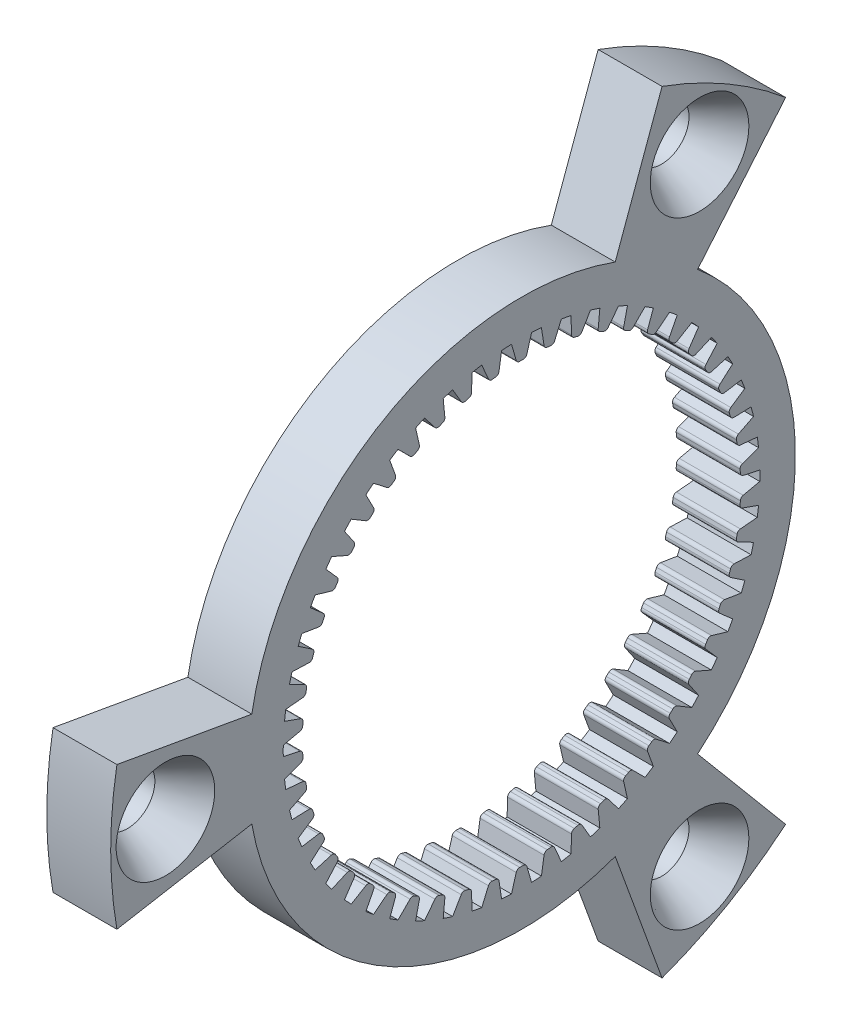
from build123d import *

# Parameters (mm, degrees)
SKETCH1_W                     = 3.5
SKETCH1_H                     = 22.5
CUT_EXTRUDE1_DEPTH            = 33.011716605
CUT_EXTRUDE2_DEPTH            = 33.011716605
CUT_EXTRUDE3_DEPTH            = 33.011716605
CUT_EXTRUDE4_DEPTH            = 32.07297861
CSK_FOR_M3_SFHCS1_D           = 3
CSK_FOR_M3_SFHCS1_DEPTH       = 9.5
CSK_FOR_M3_SFHCS1_CSINK_D     = 5.4
CSK_FOR_M3_SFHCS1_CSINK_ANGLE = 60
CSK_FOR_M3_SFHCS1_TIP         = 0.901290929
FILLET1_R                     = 0.2
CIRPATTERN1_START             = -1.5
CIRPATTERN1_DEPTH             = 3.5


# Read off the part's stored shape, not the designer's step: CirPattern1
with BuildPart() as part:
    # Sketch1 → Revolve1 (revolve)
    with BuildSketch(Plane.XY, mode=Mode.PRIVATE) as revolve1_sk:
        with Locations((0.25, 11.25)):
            Rectangle(SKETCH1_W, SKETCH1_H)
    revolve(revolve1_sk.sketch.rotate(Axis((-1.5, 0, 0), (1, 0, 0)), 270), axis=Axis((-1.5, 0, 0), (1, 0, 0)))

    # Sketch2 → Cut-Extrude1 (cut, through all)
    with BuildSketch(Plane.ZY.offset(1.5)):
        with BuildLine():
            Line((22.158174437, -3.907084003), (14.77211629, -2.604722668))
            ThreePointArc((14.77211629, -2.604722668), (7.499999995, -12.990381056), (-5.130302151, -14.095389311))
            Line((-5.130302151, -14.095389311), (-7.695453225, -21.143083968))
            ThreePointArc((-7.695453225, -21.143083968), (11.249999994, -19.485571584), (22.158174437, -3.907084003))
        make_face()
    extrude(amount=-CUT_EXTRUDE1_DEPTH, mode=Mode.SUBTRACT)

    # Sketch3 → Cut-Extrude2 (cut, through all)
    with BuildSketch(Plane.ZY.offset(1.5)):
        with BuildLine():
            Line((-14.462721218, -17.23599997), (-9.641814144, -11.490666648))
            ThreePointArc((-9.641814144, -11.490666648), (-14.999999996, -2e-09), (-9.641814142, 11.490666643))
            Line((-9.641814142, 11.490666643), (-14.462721215, 17.235999966))
            ThreePointArc((-14.462721215, 17.235999966), (-22.499999996, -1e-09), (-14.462721218, -17.23599997))
        make_face()
    extrude(amount=-CUT_EXTRUDE2_DEPTH, mode=Mode.SUBTRACT)

    # Sketch4 → Cut-Extrude3 (cut, through all)
    with BuildSketch(Plane.ZY.offset(1.5)):
        with BuildLine():
            Line((-7.695453229, 21.143083966), (-5.130302153, 14.095389311))
            ThreePointArc((-5.130302153, 14.095389311), (7.500000001, 12.990381056), (14.772116296, 2.60472266))
            Line((14.772116296, 2.60472266), (22.158174444, 3.90708399))
            ThreePointArc((22.158174444, 3.90708399), (11.250000001, 19.485571584), (-7.695453229, 21.143083966))
        make_face()
    extrude(amount=-CUT_EXTRUDE3_DEPTH, mode=Mode.SUBTRACT)

    # Sketch5 → Cut-Extrude4 (cut, through all)
    with BuildSketch(Plane.ZY.offset(1.5)):
        with BuildLine():
            Line((11.958023801, 1.002829383), (12.978235019, 1.366717155))
            ThreePointArc((12.978235019, 1.366717155), (12.947096852, 1.635598699), (12.910388636, 1.903776582))
            Line((12.910388636, 1.903776582), (11.83173402, 2.002515937))
            ThreePointArc((11.83173402, 2.002515937), (11.787447009, 2.248575775), (11.738043363, 2.493659563))
            Line((11.738043363, 2.493659563), (12.704602679, 2.982544343))
            ThreePointArc((12.704602679, 2.982544343), (12.640010253, 3.245403028), (12.569979891, 3.506865488))
            Line((12.569979891, 3.506865488), (11.487455466, 3.469634984))
            ThreePointArc((11.487455466, 3.469634984), (11.412678196, 3.708203932), (11.332946969, 3.945163242))
            Line((11.332946969, 3.945163242), (12.230611166, 4.551335025))
            ThreePointArc((12.230611166, 4.551335025), (12.133583141, 4.804025412), (12.031335054, 5.05464903))
            Line((12.031335054, 5.05464903), (10.962012876, 4.882035815))
            ThreePointArc((10.962012876, 4.882035815), (10.85792463, 5.109351498), (10.749123231, 5.33444934))
            Line((10.749123231, 5.33444934), (11.563735608, 6.048348435))
            ThreePointArc((11.563735608, 6.048348435), (11.435802174, 6.286885447), (11.302948875, 6.522717741))
            Line((11.302948875, 6.522717741), (10.263692795, 6.217444025))
            ThreePointArc((10.263692795, 6.217444025), (10.131935106, 6.429921539), (9.995779399, 6.639607986))
            Line((9.995779399, 6.639607986), (10.714493032, 7.449975777))
            ThreePointArc((10.714493032, 7.449975777), (10.557671777, 7.670597542), (10.396308442, 7.887919293))
            Line((10.396308442, 7.887919293), (9.403508148, 7.454799428))
            ThreePointArc((9.403508148, 7.454799428), (9.246158914, 7.649087876), (9.084796155, 7.840056047))
            Line((9.084796155, 7.840056047), (9.6962765, 8.73411255))
            ThreePointArc((9.6962765, 8.73411255), (9.513040588, 8.933339732), (9.325712014, 9.128723647))
            Line((9.325712014, 9.128723647), (8.39502456, 8.574588191))
            ThreePointArc((8.39502456, 8.574588191), (8.21456527, 8.74762353), (8.030540244, 8.916861745))
            Line((8.030540244, 8.916861745), (8.525143895, 9.880507151))
            ThreePointArc((8.525143895, 9.880507151), (8.318383067, 10.055197817), (8.108043537, 10.225562576))
            Line((8.108043537, 10.225562576), (7.254146419, 9.559150576))
            ThreePointArc((7.254146419, 9.559150576), (7.053423027, 9.708203933), (6.849637921, 9.853043203))
            Line((6.849637921, 9.853043203), (7.219564679, 10.871080252))
            ThreePointArc((7.219564679, 10.871080252), (6.992539674, 11.018479428), (6.762506366, 11.161138278))
            Line((6.762506366, 11.161138278), (5.998866056, 10.392959446))
            ThreePointArc((5.998866056, 10.392959446), (5.781044088, 10.515680161), (5.560712715, 10.633836283))
            Line((5.560712715, 10.633836283), (5.800128615, 11.690209923))
            ThreePointArc((5.800128615, 11.690209923), (5.556419755, 11.807993035), (5.310320434, 11.920696158))
            Line((5.310320434, 11.920696158), (4.648979992, 11.062865137))
            ThreePointArc((4.648979992, 11.062865137), (4.417494632, 11.157317831), (4.184091749, 11.246927413))
            Line((4.184091749, 11.246927413), (4.289221057, 12.324978001))
            ThreePointArc((4.289221057, 12.324978001), (4.032671777, 12.411287537), (3.774387577, 12.492257539))
            Line((3.774387577, 12.492257539), (3.225776736, 11.558302836))
            ThreePointArc((3.225776736, 11.558302836), (2.984278646, 11.622997933), (2.741485156, 11.682647779))
            Line((2.741485156, 11.682647779), (2.710669922, 12.765373812))
            ThreePointArc((2.710669922, 12.765373812), (2.445326155, 12.818848622), (2.17893037, 12.866808557))
            Line((2.17893037, 12.866808557), (1.751701054, 11.871459195))
            ThreePointArc((1.751701054, 11.871459195), (1.503998804, 11.905376416), (1.255643705, 11.934125811))
            Line((1.255643705, 11.934125811), (1.089369902, 13.004452054))
            ThreePointArc((1.089369902, 13.004452054), (0.81941628, 13.024248806), (0.549110132, 13.038442317))
            Line((0.549110132, 13.038442317), (0.25, 11.997395551))
            ThreePointArc((0.25, 11.997395551), (1e-09, 12), (-0.249999997, 11.997395551))
            Line((-0.249999997, 11.997395551), (-0.549110132, 13.038442317))
            ThreePointArc((-0.549110132, 13.038442317), (-0.819416279, 13.024248806), (-1.0893699, 13.004452054))
            Line((-1.0893699, 13.004452054), (-1.255643703, 11.934125812))
            ThreePointArc((-1.255643703, 11.934125812), (-1.503998803, 11.905376416), (-1.751701056, 11.871459195))
            Line((-1.751701056, 11.871459195), (-2.17893037, 12.866808557))
            ThreePointArc((-2.17893037, 12.866808557), (-2.445326153, 12.818848622), (-2.710669918, 12.765373813))
            Line((-2.710669918, 12.765373813), (-2.741485155, 11.68264778))
            ThreePointArc((-2.741485155, 11.68264778), (-2.984278646, 11.622997933), (-3.225776737, 11.558302836))
            Line((-3.225776737, 11.558302836), (-3.774387576, 12.492257539))
            ThreePointArc((-3.774387576, 12.492257539), (-4.032671778, 12.411287537), (-4.289221059, 12.324978))
            Line((-4.289221059, 12.324978), (-4.184091749, 11.246927413))
            ThreePointArc((-4.184091749, 11.246927413), (-4.417494632, 11.157317831), (-4.648979992, 11.062865137))
            Line((-4.648979992, 11.062865137), (-5.310320434, 11.920696158))
            ThreePointArc((-5.310320434, 11.920696158), (-5.556419755, 11.807993035), (-5.800128615, 11.690209923))
            Line((-5.800128615, 11.690209923), (-5.560712716, 10.633836283))
            ThreePointArc((-5.560712716, 10.633836283), (-5.781044089, 10.515680161), (-5.998866056, 10.392959446))
            Line((-5.998866056, 10.392959446), (-6.762506367, 11.161138277))
            ThreePointArc((-6.762506367, 11.161138277), (-6.992539674, 11.018479428), (-7.219564678, 10.871080253))
            Line((-7.219564678, 10.871080253), (-6.849637922, 9.853043202))
            ThreePointArc((-6.849637922, 9.853043202), (-7.053423027, 9.708203933), (-7.254146418, 9.559150576))
            Line((-7.254146418, 9.559150576), (-8.108043535, 10.225562578))
            ThreePointArc((-8.108043535, 10.225562578), (-8.318383066, 10.055197818), (-8.525143896, 9.880507151))
            Line((-8.525143896, 9.880507151), (-8.030540246, 8.916861744))
            ThreePointArc((-8.030540246, 8.916861744), (-8.21456527, 8.74762353), (-8.395024558, 8.574588192))
            Line((-8.395024558, 8.574588192), (-9.325712013, 9.128723648))
            ThreePointArc((-9.325712013, 9.128723648), (-9.513040588, 8.933339732), (-9.696276499, 8.73411255))
            Line((-9.696276499, 8.73411255), (-9.084796153, 7.840056049))
            ThreePointArc((-9.084796153, 7.840056049), (-9.246158912, 7.649087878), (-9.403508146, 7.45479943))
            Line((-9.403508146, 7.45479943), (-10.396308442, 7.887919294))
            ThreePointArc((-10.396308442, 7.887919294), (-10.557671776, 7.670597543), (-10.714493031, 7.449975778))
            Line((-10.714493031, 7.449975778), (-9.995779398, 6.639607987))
            ThreePointArc((-9.995779398, 6.639607987), (-10.131935107, 6.429921539), (-10.263692796, 6.217444023))
            Line((-10.263692796, 6.217444023), (-11.302948876, 6.52271774))
            ThreePointArc((-11.302948876, 6.52271774), (-11.435802174, 6.286885448), (-11.563735606, 6.048348438))
            Line((-11.563735606, 6.048348438), (-10.749123231, 5.334449341))
            ThreePointArc((-10.749123231, 5.334449341), (-10.85792463, 5.109351498), (-10.962012877, 4.882035814))
            Line((-10.962012877, 4.882035814), (-12.031335054, 5.054649031))
            ThreePointArc((-12.031335054, 5.054649031), (-12.133583141, 4.804025412), (-12.230611166, 4.551335023))
            Line((-12.230611166, 4.551335023), (-11.332946969, 3.945163242))
            ThreePointArc((-11.332946969, 3.945163242), (-11.412678196, 3.708203932), (-11.487455466, 3.469634984))
            Line((-11.487455466, 3.469634984), (-12.569979891, 3.506865487))
            ThreePointArc((-12.569979891, 3.506865487), (-12.640010253, 3.245403027), (-12.704602679, 2.982544343))
            Line((-12.704602679, 2.982544343), (-11.738043363, 2.493659563))
            ThreePointArc((-11.738043363, 2.493659563), (-11.787447009, 2.248575775), (-11.83173402, 2.002515937))
            Line((-11.83173402, 2.002515937), (-12.910388636, 1.90377658))
            ThreePointArc((-12.910388636, 1.90377658), (-12.947096852, 1.635598698), (-12.978235019, 1.366717156))
            Line((-12.978235019, 1.366717156), (-11.958023801, 1.002829382))
            ThreePointArc((-11.958023801, 1.002829382), (-11.976320741, 0.753486235), (-11.989419061, 0.503816019))
            Line((-11.989419061, 0.503816019), (-13.04719284, 0.270663979))
            ThreePointArc((-13.04719284, 0.270663979), (-13.05, -1e-09), (-13.04719284, -0.270663981))
            Line((-13.04719284, -0.270663981), (-11.989419061, -0.503816018))
            ThreePointArc((-11.989419061, -0.503816018), (-11.976320741, -0.753486235), (-11.958023801, -1.002829382))
            Line((-11.958023801, -1.002829382), (-12.978235019, -1.366717157))
            ThreePointArc((-12.978235019, -1.366717157), (-12.947096852, -1.635598699), (-12.910388636, -1.90377658))
            Line((-12.910388636, -1.90377658), (-11.83173402, -2.002515936))
            ThreePointArc((-11.83173402, -2.002515936), (-11.787447009, -2.248575775), (-11.738043363, -2.493659563))
            Line((-11.738043363, -2.493659563), (-12.704602679, -2.982544343))
            ThreePointArc((-12.704602679, -2.982544343), (-12.640010253, -3.245403027), (-12.569979891, -3.506865487))
            Line((-12.569979891, -3.506865487), (-11.487455466, -3.469634983))
            ThreePointArc((-11.487455466, -3.469634983), (-11.412678196, -3.708203931), (-11.332946969, -3.945163242))
            Line((-11.332946969, -3.945163242), (-12.230611166, -4.551335024))
            ThreePointArc((-12.230611166, -4.551335024), (-12.133583141, -4.804025412), (-12.031335054, -5.054649031))
            Line((-12.031335054, -5.054649031), (-10.962012877, -4.882035813))
            ThreePointArc((-10.962012877, -4.882035813), (-10.85792463, -5.109351497), (-10.749123231, -5.334449341))
            Line((-10.749123231, -5.334449341), (-11.563735609, -6.048348433))
            ThreePointArc((-11.563735609, -6.048348433), (-11.435802175, -6.286885446), (-11.302948876, -6.52271774))
            Line((-11.302948876, -6.52271774), (-10.263692794, -6.217444027))
            ThreePointArc((-10.263692794, -6.217444027), (-10.131935105, -6.429921541), (-9.995779398, -6.639607987))
            Line((-9.995779398, -6.639607987), (-10.714493034, -7.449975773))
            ThreePointArc((-10.714493034, -7.449975773), (-10.557671778, -7.670597541), (-10.396308442, -7.887919294))
            Line((-10.396308442, -7.887919294), (-9.403508147, -7.454799429))
            ThreePointArc((-9.403508147, -7.454799429), (-9.246158913, -7.649087878), (-9.084796153, -7.840056049))
            Line((-9.084796153, -7.840056049), (-9.696276504, -8.734112546))
            ThreePointArc((-9.696276504, -8.734112546), (-9.51304059, -8.93333973), (-9.325712013, -9.128723648))
            Line((-9.325712013, -9.128723648), (-8.395024559, -8.574588191))
            ThreePointArc((-8.395024559, -8.574588191), (-8.214565271, -8.747623529), (-8.030540246, -8.916861744))
            Line((-8.030540246, -8.916861744), (-8.525143893, -9.880507153))
            ThreePointArc((-8.525143893, -9.880507153), (-8.318383065, -10.055197819), (-8.108043535, -10.225562578))
            Line((-8.108043535, -10.225562578), (-7.254146419, -9.559150576))
            ThreePointArc((-7.254146419, -9.559150576), (-7.053423027, -9.708203933), (-6.849637922, -9.853043202))
            Line((-6.849637922, -9.853043202), (-7.219564677, -10.871080253))
            ThreePointArc((-7.219564677, -10.871080253), (-6.992539674, -11.018479428), (-6.762506367, -11.161138277))
            Line((-6.762506367, -11.161138277), (-5.998866057, -10.392959445))
            ThreePointArc((-5.998866057, -10.392959445), (-5.78104409, -10.51568016), (-5.560712716, -10.633836283))
            Line((-5.560712716, -10.633836283), (-5.800128615, -11.690209923))
            ThreePointArc((-5.800128615, -11.690209923), (-5.556419755, -11.807993035), (-5.310320434, -11.920696158))
            Line((-5.310320434, -11.920696158), (-4.648979993, -11.062865136))
            ThreePointArc((-4.648979993, -11.062865136), (-4.417494633, -11.15731783), (-4.184091749, -11.246927413))
            Line((-4.184091749, -11.246927413), (-4.289221058, -12.324978))
            ThreePointArc((-4.289221058, -12.324978), (-4.032671777, -12.411287537), (-3.774387576, -12.492257539))
            Line((-3.774387576, -12.492257539), (-3.225776739, -11.558302835))
            ThreePointArc((-3.225776739, -11.558302835), (-2.984278647, -11.622997933), (-2.741485155, -11.68264778))
            Line((-2.741485155, -11.68264778), (-2.710669925, -12.765373812))
            ThreePointArc((-2.710669925, -12.765373812), (-2.445326157, -12.818848622), (-2.17893037, -12.866808557))
            Line((-2.17893037, -12.866808557), (-1.751701051, -11.871459195))
            ThreePointArc((-1.751701051, -11.871459195), (-1.503998801, -11.905376416), (-1.255643703, -11.934125812))
            Line((-1.255643703, -11.934125812), (-1.089369906, -13.004452053))
            ThreePointArc((-1.089369906, -13.004452053), (-0.819416282, -13.024248806), (-0.549110132, -13.038442317))
            Line((-0.549110132, -13.038442317), (-0.249999998, -11.997395551))
            ThreePointArc((-0.249999998, -11.997395551), (1e-09, -12), (0.25, -11.997395551))
            Line((0.25, -11.997395551), (0.549110126, -13.038442317))
            ThreePointArc((0.549110126, -13.038442317), (0.819416277, -13.024248806), (1.089369902, -13.004452054))
            Line((1.089369902, -13.004452054), (1.255643704, -11.934125812))
            ThreePointArc((1.255643704, -11.934125812), (1.503998803, -11.905376416), (1.751701054, -11.871459195))
            Line((1.751701054, -11.871459195), (2.178930373, -12.866808556))
            ThreePointArc((2.178930373, -12.866808556), (2.445326157, -12.818848622), (2.710669922, -12.765373812))
            Line((2.710669922, -12.765373812), (2.741485155, -11.68264778))
            ThreePointArc((2.741485155, -11.68264778), (2.984278646, -11.622997934), (3.225776736, -11.558302836))
            Line((3.225776736, -11.558302836), (3.774387577, -12.492257539))
            ThreePointArc((3.774387577, -12.492257539), (4.032671777, -12.411287537), (4.289221057, -12.324978001))
            Line((4.289221057, -12.324978001), (4.184091748, -11.246927413))
            ThreePointArc((4.184091748, -11.246927413), (4.417494632, -11.157317831), (4.648979992, -11.062865137))
            Line((4.648979992, -11.062865137), (5.310320434, -11.920696158))
            ThreePointArc((5.310320434, -11.920696158), (5.556419755, -11.807993034), (5.800128615, -11.690209923))
            Line((5.800128615, -11.690209923), (5.560712715, -10.633836283))
            ThreePointArc((5.560712715, -10.633836283), (5.781044088, -10.515680161), (5.998866056, -10.392959446))
            Line((5.998866056, -10.392959446), (6.762506366, -11.161138277))
            ThreePointArc((6.762506366, -11.161138277), (6.992539674, -11.018479428), (7.219564679, -10.871080252))
            Line((7.219564679, -10.871080252), (6.84963792, -9.853043203))
            ThreePointArc((6.84963792, -9.853043203), (7.053423026, -9.708203933), (7.254146419, -9.559150576))
            Line((7.254146419, -9.559150576), (8.108043533, -10.225562579))
            ThreePointArc((8.108043533, -10.225562579), (8.318383065, -10.055197819), (8.525143895, -9.880507151))
            Line((8.525143895, -9.880507151), (8.030540248, -8.916861742))
            ThreePointArc((8.030540248, -8.916861742), (8.214565272, -8.747623528), (8.39502456, -8.574588191))
            Line((8.39502456, -8.574588191), (9.32571201, -9.128723651))
            ThreePointArc((9.32571201, -9.128723651), (9.513040587, -8.933339734), (9.6962765, -8.73411255))
            Line((9.6962765, -8.73411255), (9.084796154, -7.840056048))
            ThreePointArc((9.084796154, -7.840056048), (9.246158914, -7.649087876), (9.403508148, -7.454799428))
            Line((9.403508148, -7.454799428), (10.396308438, -7.887919298))
            ThreePointArc((10.396308438, -7.887919298), (10.557671775, -7.670597545), (10.714493032, -7.449975777))
            Line((10.714493032, -7.449975777), (9.995779399, -6.639607986))
            ThreePointArc((9.995779399, -6.639607986), (10.131935106, -6.429921539), (10.263692795, -6.217444025))
            Line((10.263692795, -6.217444025), (11.302948877, -6.522717737))
            ThreePointArc((11.302948877, -6.522717737), (11.435802175, -6.286885446), (11.563735608, -6.048348435))
            Line((11.563735608, -6.048348435), (10.749123231, -5.334449341))
            ThreePointArc((10.749123231, -5.334449341), (10.85792463, -5.109351498), (10.962012876, -4.882035815))
            Line((10.962012876, -4.882035815), (12.031335054, -5.05464903))
            ThreePointArc((12.031335054, -5.05464903), (12.133583141, -4.804025412), (12.230611166, -4.551335025))
            Line((12.230611166, -4.551335025), (11.332946968, -3.945163243))
            ThreePointArc((11.332946968, -3.945163243), (11.412678195, -3.708203933), (11.487455466, -3.469634984))
            Line((11.487455466, -3.469634984), (12.569979891, -3.506865487))
            ThreePointArc((12.569979891, -3.506865487), (12.640010253, -3.245403027), (12.704602679, -2.982544343))
            Line((12.704602679, -2.982544343), (11.738043362, -2.493659564))
            ThreePointArc((11.738043362, -2.493659564), (11.787447009, -2.248575776), (11.83173402, -2.002515937))
            Line((11.83173402, -2.002515937), (12.910388636, -1.903776581))
            ThreePointArc((12.910388636, -1.903776581), (12.947096852, -1.635598699), (12.978235019, -1.366717155))
            Line((12.978235019, -1.366717155), (11.958023801, -1.002829385))
            ThreePointArc((11.958023801, -1.002829385), (11.976320741, -0.753486236), (11.989419061, -0.503816018))
            Line((11.989419061, -0.503816018), (13.04719284, -0.27066398))
            ThreePointArc((13.04719284, -0.27066398), (13.05, -1e-09), (13.04719284, 0.270663979))
            Line((13.04719284, 0.270663979), (11.989419061, 0.503816018))
            ThreePointArc((11.989419061, 0.503816018), (11.976320741, 0.753486235), (11.958023801, 1.002829383))
        make_face()
    extrude(amount=-CUT_EXTRUDE4_DEPTH, mode=Mode.SUBTRACT)

    # CSK for M3 SFHCS1
    with Locations(Plane(origin=(2, 0, 0), x_dir=(0, 0, -1), z_dir=(1, 0, 0))):
        with Locations((9.75, -16.887495374), (-19.5, 0), (9.75, 16.887495374)):
            CounterSinkHole(CSK_FOR_M3_SFHCS1_D / 2, CSK_FOR_M3_SFHCS1_CSINK_D / 2, depth=CSK_FOR_M3_SFHCS1_DEPTH, counter_sink_angle=CSK_FOR_M3_SFHCS1_CSINK_ANGLE)
            with Locations((0, 0, -(CSK_FOR_M3_SFHCS1_DEPTH + CSK_FOR_M3_SFHCS1_TIP / 2))):  # 118° drill point
                Cone(0, CSK_FOR_M3_SFHCS1_D / 2, CSK_FOR_M3_SFHCS1_TIP, mode=Mode.SUBTRACT)

    # Fillet1
    fillet1_edges = [part.edges().sort_by_distance(p)[0] for p in [
        (0.25, 11.871459195, -1.751701056),
        (0.25, 11.934125812, -1.255643703),
    ]]
    fillet(fillet1_edges, radius=FILLET1_R)

    # CirPattern1 outline → CirPattern1 (cut)
    with BuildSketch(Plane.YZ.offset(CIRPATTERN1_START)):
        with BuildLine():
            Line((11.997395551, -0.249999997), (12.144361196, -0.292225687))
            ThreePointArc((12.144361196, -0.292225687), (12.039339482, -0.219667537), (11.999596856, -0.098363088))
            ThreePointArc((11.999596856, -0.098363088), (11.998735749, -0.17418502), (11.997395551, -0.249999997))
        make_face()
        with BuildLine():
            ThreePointArc((11.997395551, 0.25), (11.998735749, 0.174185021), (11.999596856, 0.098363087))
            ThreePointArc((11.999596856, 0.098363087), (12.039339481, 0.219667536), (12.144361195, 0.292225686))
            Line((12.144361195, 0.292225686), (11.997395551, 0.25))
        make_face()
        with BuildLine():
            Line((11.934125811, 1.255643705), (12.085224871, 1.232170658))
            ThreePointArc((12.085224871, 1.232170658), (11.971937336, 1.290993954), (11.917304614, 1.40636081))
            ThreePointArc((11.917304614, 1.40636081), (11.925953306, 1.331028831), (11.934125811, 1.255643705))
        make_face()
        with BuildLine():
            ThreePointArc((11.871459195, 1.751701054), (11.882290962, 1.67665187), (11.892648287, 1.60153574))
            ThreePointArc((11.892648287, 1.60153574), (11.916874051, 1.726864739), (12.01197369, 1.812013457))
            Line((12.01197369, 1.812013457), (11.871459195, 1.751701054))
        make_face()
        with BuildLine():
            Line((11.682647779, 2.741485156), (11.83549733, 2.737134936))
            ThreePointArc((11.83549733, 2.737134936), (11.715730588, 2.7812957), (11.64706936, 2.888905557))
            ThreePointArc((11.64706936, 2.888905557), (11.665091454, 2.815251561), (11.682647779, 2.741485156))
        make_face()
        with BuildLine():
            ThreePointArc((11.558302836, 3.225776736), (11.578455348, 3.152676918), (11.598145549, 3.079451218))
            ThreePointArc((11.598145549, 3.079451218), (11.606472398, 3.206828253), (11.690150183, 3.303224694))
            Line((11.690150183, 3.303224694), (11.558302836, 3.225776736))
        make_face()
        with BuildLine():
            Line((11.246927413, 4.184091749), (11.399116926, 4.19893296))
            ThreePointArc((11.399116926, 4.19893296), (11.274759769, 4.227734751), (11.193152864, 4.325890539))
            ThreePointArc((11.193152864, 4.325890539), (11.220264143, 4.255076094), (11.246927413, 4.184091749))
        make_face()
        with BuildLine():
            ThreePointArc((11.062865137, 4.648979992), (11.092020577, 4.578982367), (11.12073313, 4.50880191))
            ThreePointArc((11.12073313, 4.50880191), (11.113029742, 4.636218171), (11.183966026, 4.742342104))
            Line((11.183966026, 4.742342104), (11.062865137, 4.648979992))
        make_face()
        with BuildLine():
            Line((10.633836283, 5.560712715), (10.782965639, 5.594511304))
            ThreePointArc((10.782965639, 5.594511304), (10.655979254, 5.607499899), (10.562713662, 5.694653642))
            ThreePointArc((10.562713662, 5.694653642), (10.598486563, 5.627795533), (10.633836283, 5.560712715))
        make_face()
        with BuildLine():
            ThreePointArc((10.392959446, 5.998866056), (10.430658015, 5.933074529), (10.467940104, 5.867046103))
            ThreePointArc((10.467940104, 5.867046103), (10.444327969, 5.992492158), (10.501404043, 6.106669946))
            Line((10.501404043, 6.106669946), (10.392959446, 5.998866056))
        make_face()
        with BuildLine():
            Line((9.853043203, 6.849637921), (9.996760542, 6.901860862))
            ThreePointArc((9.996760542, 6.901860862), (9.86914758, 6.898831424), (9.765694155, 6.973608655))
            ThreePointArc((9.765694155, 6.973608655), (9.80956452, 6.911761276), (9.853043203, 6.849637921))
        make_face()
        with BuildLine():
            ThreePointArc((9.559150576, 7.254146419), (9.604797746, 7.193598561), (9.65006141, 7.132763474))
            ThreePointArc((9.65006141, 7.132763474), (9.610912904, 7.254260964), (9.653228644, 7.374691955))
            Line((9.653228644, 7.374691955), (9.559150576, 7.254146419))
        make_face()
        with BuildLine():
            Line((8.916861745, 8.030540244), (9.05290056, 8.100363952))
            ThreePointArc((9.05290056, 8.100363952), (8.926673554, 8.081364257), (8.814663817, 8.142585695))
            ThreePointArc((8.814663817, 8.142585695), (8.865939783, 8.086724415), (8.916861745, 8.030540244))
        make_face()
        with BuildLine():
            ThreePointArc((8.574588191, 8.39502456), (8.627464078, 8.340675248), (8.679995483, 8.285992905))
            ThreePointArc((8.679995483, 8.285992905), (8.625928001, 8.401625742), (8.652816064, 8.526410667))
            Line((8.652816064, 8.526410667), (8.574588191, 8.39502456))
        make_face()
        with BuildLine():
            Line((7.840056047, 9.084796155), (7.966270928, 9.171119463))
            ThreePointArc((7.966270928, 9.171119463), (7.843420552, 9.136449147), (7.724620965, 9.183149293))
            ThreePointArc((7.724620965, 9.183149293), (7.782493878, 9.134155081), (7.840056047, 9.084796155))
        make_face()
        with BuildLine():
            ThreePointArc((7.454799428, 9.403508148), (7.514070148, 9.356214502), (7.573040842, 9.308547277))
            ThreePointArc((7.573040842, 9.308547277), (7.504907061, 9.416491862), (7.515943405, 9.543662789))
            Line((7.515943405, 9.543662789), (7.454799428, 9.403508148))
        make_face()
        with BuildLine():
            Line((6.639607986, 9.995779399), (6.754008445, 10.097240942))
            ThreePointArc((6.754008445, 10.097240942), (6.636472124, 10.047446777), (6.512756226, 10.078889142))
            ThreePointArc((6.512756226, 10.078889142), (6.576313397, 10.037534662), (6.639607986, 9.995779399))
        make_face()
        with BuildLine():
            ThreePointArc((6.217444025, 10.263692795), (6.282174843, 10.224200665), (6.346654823, 10.184300298))
            ThreePointArc((6.346654823, 10.184300298), (6.265529253, 10.28285428), (6.260539829, 10.410405647))
            Line((6.260539829, 10.410405647), (6.217444025, 10.263692795))
        make_face()
        with BuildLine():
            Line((5.33444934, 10.749123231), (5.435231214, 10.864122899))
            ThreePointArc((5.435231214, 10.864122899), (5.324862565, 10.799990169), (5.198181431, 10.815678888))
            ThreePointArc((5.198181431, 10.815678888), (5.266420526, 10.782616327), (5.33444934, 10.749123231))
        make_face()
        with BuildLine():
            ThreePointArc((4.882035815, 10.962012876), (4.951205888, 10.930945076), (5.020178266, 10.899440819))
            ThreePointArc((5.020178266, 10.899440819), (4.927340306, 10.987049944), (4.9064038, 11.11297019))
            Line((4.9064038, 11.11297019), (4.882035815, 10.962012876))
        make_face()
        with BuildLine():
            Line((3.945163242, 11.332946969), (4.030737139, 11.459671148))
            ThreePointArc((4.030737139, 11.459671148), (3.929276743, 11.382211264), (3.80162821, 11.381898917))
            ThreePointArc((3.80162821, 11.381898917), (3.873473057, 11.35764969), (3.945163242, 11.332946969))
        make_face()
        with BuildLine():
            ThreePointArc((3.469634984, 11.487455466), (3.542153458, 11.465301954), (3.614530499, 11.442690648))
            ThreePointArc((3.614530499, 11.442690648), (3.51144426, 11.517973267), (3.474890852, 11.640276554))
            Line((3.474890852, 11.640276554), (3.469634984, 11.487455466))
        make_face()
        with BuildLine():
            Line((2.493659563, 11.738043363), (2.562675932, 11.874493537))
            ThreePointArc((2.562675932, 11.874493537), (2.47172388, 11.784928088), (2.345121041, 11.768619601))
            ThreePointArc((2.345121041, 11.768619601), (2.419438604, 11.753566133), (2.493659563, 11.738043363))
        make_face()
        with BuildLine():
            ThreePointArc((2.002515937, 11.83173402), (2.077239153, 11.81884417), (2.151879427, 11.80548241))
            ThreePointArc((2.151879427, 11.80548241), (2.040170639, 11.867251272), (1.9885768, 11.984008804))
            Line((1.9885768, 11.984008804), (2.002515937, 11.83173402))
        make_face()
        with BuildLine():
            Line((1.002829383, 11.958023801), (1.054199795, 12.10204807))
            ThreePointArc((1.054199795, 12.10204807), (0.975190454, 12.001789556), (0.851629912, 11.969742123))
            ThreePointArc((0.851629912, 11.969742123), (0.927248159, 11.964121817), (1.002829383, 11.958023801))
        make_face()
        with BuildLine():
            ThreePointArc((0.503816018, 11.989419061), (0.579565545, 11.985996153), (0.655291931, 11.982094662))
            ThreePointArc((0.655291931, 11.982094662), (0.536722309, 12.029375634), (0.470901703, 12.138746075))
            Line((0.470901703, 12.138746075), (0.503816018, 11.989419061))
        make_face()
        with BuildLine():
            Line((-0.503816018, 11.989419061), (-0.470901702, 12.138746076))
            ThreePointArc((-0.470901702, 12.138746076), (-0.536722308, 12.029375634), (-0.65529193, 11.982094662))
            ThreePointArc((-0.65529193, 11.982094662), (-0.579565545, 11.985996153), (-0.503816018, 11.989419061))
        make_face()
        with BuildLine():
            ThreePointArc((-1.002829385, 11.958023801), (-0.92724816, 11.964121817), (-0.851629911, 11.969742123))
            ThreePointArc((-0.851629911, 11.969742123), (-0.975190453, 12.001789557), (-1.054199794, 12.102048071))
            Line((-1.054199794, 12.102048071), (-1.002829385, 11.958023801))
        make_face()
        with BuildLine():
            Line((-2.002515937, 11.83173402), (-1.988576799, 11.984008804))
            ThreePointArc((-1.988576799, 11.984008804), (-2.040170638, 11.867251272), (-2.151879426, 11.80548241))
            ThreePointArc((-2.151879426, 11.80548241), (-2.077239152, 11.81884417), (-2.002515937, 11.83173402))
        make_face()
        with BuildLine():
            ThreePointArc((-2.493659564, 11.738043362), (-2.419438604, 11.753566133), (-2.34512104, 11.768619601))
            ThreePointArc((-2.34512104, 11.768619601), (-2.471723879, 11.784928088), (-2.562675931, 11.874493537))
            Line((-2.562675931, 11.874493537), (-2.493659564, 11.738043362))
        make_face()
        with BuildLine():
            Line((-3.469634984, 11.487455466), (-3.474890851, 11.640276555))
            ThreePointArc((-3.474890851, 11.640276555), (-3.511444259, 11.517973268), (-3.614530498, 11.442690648))
            ThreePointArc((-3.614530498, 11.442690648), (-3.542153458, 11.465301953), (-3.469634984, 11.487455466))
        make_face()
        with BuildLine():
            ThreePointArc((-3.945163243, 11.332946968), (-3.873473057, 11.357649689), (-3.801628209, 11.381898917))
            ThreePointArc((-3.801628209, 11.381898917), (-3.929276742, 11.382211264), (-4.030737138, 11.459671148))
            Line((-4.030737138, 11.459671148), (-3.945163243, 11.332946968))
        make_face()
        with BuildLine():
            Line((-4.882035815, 10.962012876), (-4.906403799, 11.112970191))
            ThreePointArc((-4.906403799, 11.112970191), (-4.927340305, 10.987049945), (-5.020178265, 10.89944082))
            ThreePointArc((-5.020178265, 10.89944082), (-4.951205887, 10.930945076), (-4.882035815, 10.962012876))
        make_face()
        with BuildLine():
            ThreePointArc((-5.334449341, 10.749123231), (-5.266420526, 10.782616327), (-5.198181431, 10.815678888))
            ThreePointArc((-5.198181431, 10.815678888), (-5.324862564, 10.799990169), (-5.435231212, 10.864122899))
            Line((-5.435231212, 10.864122899), (-5.334449341, 10.749123231))
        make_face()
        with BuildLine():
            Line((-6.217444025, 10.263692795), (-6.260539828, 10.410405648))
            ThreePointArc((-6.260539828, 10.410405648), (-6.265529252, 10.282854281), (-6.346654822, 10.184300298))
            ThreePointArc((-6.346654822, 10.184300298), (-6.282174842, 10.224200665), (-6.217444025, 10.263692795))
        make_face()
        with BuildLine():
            ThreePointArc((-6.639607986, 9.995779399), (-6.576313397, 10.037534662), (-6.512756226, 10.078889142))
            ThreePointArc((-6.512756226, 10.078889142), (-6.636472123, 10.047446777), (-6.754008443, 10.097240942))
            Line((-6.754008443, 10.097240942), (-6.639607986, 9.995779399))
        make_face()
        with BuildLine():
            Line((-7.454799428, 9.403508148), (-7.515943405, 9.54366279))
            ThreePointArc((-7.515943405, 9.54366279), (-7.50490706, 9.416491863), (-7.573040841, 9.308547277))
            ThreePointArc((-7.573040841, 9.308547277), (-7.514070148, 9.356214503), (-7.454799428, 9.403508148))
        make_face()
        with BuildLine():
            ThreePointArc((-7.840056048, 9.084796154), (-7.782493878, 9.134155081), (-7.724620964, 9.183149294))
            ThreePointArc((-7.724620964, 9.183149294), (-7.843420551, 9.136449148), (-7.966270927, 9.171119463))
            Line((-7.966270927, 9.171119463), (-7.840056048, 9.084796154))
        make_face()
        with BuildLine():
            Line((-8.574588191, 8.39502456), (-8.652816063, 8.526410668))
            ThreePointArc((-8.652816063, 8.526410668), (-8.625928, 8.401625742), (-8.679995482, 8.285992905))
            ThreePointArc((-8.679995482, 8.285992905), (-8.627464078, 8.340675248), (-8.574588191, 8.39502456))
        make_face()
        with BuildLine():
            ThreePointArc((-8.916861742, 8.030540248), (-8.865939781, 8.086724417), (-8.814663816, 8.142585695))
            ThreePointArc((-8.814663816, 8.142585695), (-8.926673553, 8.081364257), (-9.052900559, 8.100363952))
            Line((-9.052900559, 8.100363952), (-8.916861742, 8.030540248))
        make_face()
        with BuildLine():
            Line((-9.559150576, 7.254146419), (-9.653228644, 7.374691956))
            ThreePointArc((-9.653228644, 7.374691956), (-9.610912903, 7.254260965), (-9.650061409, 7.132763475))
            ThreePointArc((-9.650061409, 7.132763475), (-9.604797745, 7.193598562), (-9.559150576, 7.254146419))
        make_face()
        with BuildLine():
            ThreePointArc((-9.853043203, 6.84963792), (-9.809564519, 6.911761276), (-9.765694154, 6.973608656))
            ThreePointArc((-9.765694154, 6.973608656), (-9.86914758, 6.898831425), (-9.996760542, 6.901860863))
            Line((-9.996760542, 6.901860863), (-9.853043203, 6.84963792))
        make_face()
        with BuildLine():
            Line((-10.392959446, 5.998866056), (-10.501404042, 6.106669947))
            ThreePointArc((-10.501404042, 6.106669947), (-10.444327968, 5.992492159), (-10.467940103, 5.867046104))
            ThreePointArc((-10.467940103, 5.867046104), (-10.430658015, 5.93307453), (-10.392959446, 5.998866056))
        make_face()
        with BuildLine():
            ThreePointArc((-10.633836283, 5.560712715), (-10.598486563, 5.627795534), (-10.562713661, 5.694653643))
            ThreePointArc((-10.562713661, 5.694653643), (-10.655979254, 5.6074999), (-10.782965639, 5.594511305))
            Line((-10.782965639, 5.594511305), (-10.633836283, 5.560712715))
        make_face()
        with BuildLine():
            Line((-11.062865137, 4.648979992), (-11.183966026, 4.742342105))
            ThreePointArc((-11.183966026, 4.742342105), (-11.113029742, 4.636218172), (-11.120733129, 4.508801911))
            ThreePointArc((-11.120733129, 4.508801911), (-11.092020577, 4.578982368), (-11.062865137, 4.648979992))
        make_face()
        with BuildLine():
            ThreePointArc((-11.246927413, 4.184091748), (-11.220264143, 4.255076093), (-11.193152864, 4.325890539))
            ThreePointArc((-11.193152864, 4.325890539), (-11.274759769, 4.227734752), (-11.399116926, 4.198932961))
            Line((-11.399116926, 4.198932961), (-11.246927413, 4.184091748))
        make_face()
        with BuildLine():
            Line((-11.558302836, 3.225776736), (-11.690150184, 3.303224695))
            ThreePointArc((-11.690150184, 3.303224695), (-11.606472398, 3.206828255), (-11.59814555, 3.079451219))
            ThreePointArc((-11.59814555, 3.079451219), (-11.578455348, 3.152676918), (-11.558302836, 3.225776736))
        make_face()
        with BuildLine():
            ThreePointArc((-11.68264778, 2.741485155), (-11.665091455, 2.815251561), (-11.64706936, 2.888905558))
            ThreePointArc((-11.64706936, 2.888905558), (-11.715730588, 2.781295701), (-11.835497329, 2.737134937))
            Line((-11.835497329, 2.737134937), (-11.68264778, 2.741485155))
        make_face()
        with BuildLine():
            Line((-11.871459195, 1.751701054), (-12.01197369, 1.812013458))
            ThreePointArc((-12.01197369, 1.812013458), (-11.916874051, 1.72686474), (-11.892648287, 1.601535741))
            ThreePointArc((-11.892648287, 1.601535741), (-11.882290962, 1.676651871), (-11.871459195, 1.751701054))
        make_face()
        with BuildLine():
            ThreePointArc((-11.934125812, 1.255643704), (-11.925953306, 1.331028831), (-11.917304615, 1.406360811))
            ThreePointArc((-11.917304615, 1.406360811), (-11.971937336, 1.290993956), (-12.08522487, 1.232170659))
            Line((-12.08522487, 1.232170659), (-11.934125812, 1.255643704))
        make_face()
        with BuildLine():
            Line((-11.997395551, 0.25), (-12.144361196, 0.292225687))
            ThreePointArc((-12.144361196, 0.292225687), (-12.039339482, 0.219667537), (-11.999596856, 0.098363088))
            ThreePointArc((-11.999596856, 0.098363088), (-11.998735749, 0.174185021), (-11.997395551, 0.25))
        make_face()
        with BuildLine():
            ThreePointArc((-11.997395551, -0.249999998), (-11.998735749, -0.17418502), (-11.999596856, -0.098363087))
            ThreePointArc((-11.999596856, -0.098363087), (-12.039339481, -0.219667536), (-12.144361195, -0.292225686))
            Line((-12.144361195, -0.292225686), (-11.997395551, -0.249999998))
        make_face()
        with BuildLine():
            Line((-11.934125812, -1.255643703), (-12.085224871, -1.232170658))
            ThreePointArc((-12.085224871, -1.232170658), (-11.971937336, -1.290993954), (-11.917304614, -1.40636081))
            ThreePointArc((-11.917304614, -1.40636081), (-11.925953306, -1.33102883), (-11.934125812, -1.255643703))
        make_face()
        with BuildLine():
            ThreePointArc((-11.871459195, -1.751701051), (-11.882290962, -1.676651869), (-11.892648287, -1.60153574))
            ThreePointArc((-11.892648287, -1.60153574), (-11.916874051, -1.726864739), (-12.01197369, -1.812013457))
            Line((-12.01197369, -1.812013457), (-11.871459195, -1.751701051))
        make_face()
        with BuildLine():
            Line((-11.68264778, -2.741485155), (-11.83549733, -2.737134936))
            ThreePointArc((-11.83549733, -2.737134936), (-11.715730588, -2.7812957), (-11.64706936, -2.888905557))
            ThreePointArc((-11.64706936, -2.888905557), (-11.665091455, -2.81525156), (-11.68264778, -2.741485155))
        make_face()
        with BuildLine():
            ThreePointArc((-11.558302835, -3.225776739), (-11.578455348, -3.152676919), (-11.59814555, -3.079451218))
            ThreePointArc((-11.59814555, -3.079451218), (-11.606472398, -3.206828254), (-11.690150184, -3.303224694))
            Line((-11.690150184, -3.303224694), (-11.558302835, -3.225776739))
        make_face()
        with BuildLine():
            Line((-11.246927413, -4.184091749), (-11.399116926, -4.19893296))
            ThreePointArc((-11.399116926, -4.19893296), (-11.274759769, -4.227734751), (-11.193152864, -4.325890539))
            ThreePointArc((-11.193152864, -4.325890539), (-11.220264143, -4.255076093), (-11.246927413, -4.184091749))
        make_face()
        with BuildLine():
            ThreePointArc((-11.062865136, -4.648979993), (-11.092020577, -4.578982368), (-11.120733129, -4.50880191))
            ThreePointArc((-11.120733129, -4.50880191), (-11.113029742, -4.636218171), (-11.183966026, -4.742342104))
            Line((-11.183966026, -4.742342104), (-11.062865136, -4.648979993))
        make_face()
        with BuildLine():
            Line((-10.633836283, -5.560712716), (-10.782965639, -5.594511304))
            ThreePointArc((-10.782965639, -5.594511304), (-10.655979254, -5.607499899), (-10.562713662, -5.694653642))
            ThreePointArc((-10.562713662, -5.694653642), (-10.598486563, -5.627795534), (-10.633836283, -5.560712716))
        make_face()
        with BuildLine():
            ThreePointArc((-10.392959445, -5.998866057), (-10.430658015, -5.933074529), (-10.467940104, -5.867046103))
            ThreePointArc((-10.467940104, -5.867046103), (-10.444327969, -5.992492158), (-10.501404043, -6.106669946))
            Line((-10.501404043, -6.106669946), (-10.392959445, -5.998866057))
        make_face()
        with BuildLine():
            Line((-9.853043202, -6.849637922), (-9.996760542, -6.901860862))
            ThreePointArc((-9.996760542, -6.901860862), (-9.86914758, -6.898831424), (-9.765694155, -6.973608655))
            ThreePointArc((-9.765694155, -6.973608655), (-9.809564519, -6.911761277), (-9.853043202, -6.849637922))
        make_face()
        with BuildLine():
            ThreePointArc((-9.559150576, -7.254146419), (-9.604797746, -7.193598561), (-9.65006141, -7.132763474))
            ThreePointArc((-9.65006141, -7.132763474), (-9.610912904, -7.254260964), (-9.653228644, -7.374691955))
            Line((-9.653228644, -7.374691955), (-9.559150576, -7.254146419))
        make_face()
        with BuildLine():
            Line((-8.916861744, -8.030540246), (-9.05290056, -8.100363952))
            ThreePointArc((-9.05290056, -8.100363952), (-8.926673554, -8.081364257), (-8.814663817, -8.142585695))
            ThreePointArc((-8.814663817, -8.142585695), (-8.865939782, -8.086724416), (-8.916861744, -8.030540246))
        make_face()
        with BuildLine():
            ThreePointArc((-8.574588191, -8.395024559), (-8.627464078, -8.340675247), (-8.679995483, -8.285992905))
            ThreePointArc((-8.679995483, -8.285992905), (-8.625928001, -8.401625742), (-8.652816064, -8.526410667))
            Line((-8.652816064, -8.526410667), (-8.574588191, -8.395024559))
        make_face()
        with BuildLine():
            Line((-7.840056049, -9.084796153), (-7.966270928, -9.171119463))
            ThreePointArc((-7.966270928, -9.171119463), (-7.843420552, -9.136449147), (-7.724620965, -9.183149293))
            ThreePointArc((-7.724620965, -9.183149293), (-7.782493879, -9.13415508), (-7.840056049, -9.084796153))
        make_face()
        with BuildLine():
            ThreePointArc((-7.454799429, -9.403508147), (-7.514070148, -9.356214502), (-7.573040842, -9.308547277))
            ThreePointArc((-7.573040842, -9.308547277), (-7.504907061, -9.416491862), (-7.515943405, -9.543662789))
            Line((-7.515943405, -9.543662789), (-7.454799429, -9.403508147))
        make_face()
        with BuildLine():
            Line((-6.639607987, -9.995779398), (-6.754008445, -10.097240942))
            ThreePointArc((-6.754008445, -10.097240942), (-6.636472124, -10.047446777), (-6.512756226, -10.078889142))
            ThreePointArc((-6.512756226, -10.078889142), (-6.576313398, -10.037534662), (-6.639607987, -9.995779398))
        make_face()
        with BuildLine():
            ThreePointArc((-6.217444027, -10.263692794), (-6.282174844, -10.224200664), (-6.346654823, -10.184300298))
            ThreePointArc((-6.346654823, -10.184300298), (-6.265529253, -10.28285428), (-6.260539829, -10.410405647))
            Line((-6.260539829, -10.410405647), (-6.217444027, -10.263692794))
        make_face()
        with BuildLine():
            Line((-5.334449341, -10.749123231), (-5.435231214, -10.864122899))
            ThreePointArc((-5.435231214, -10.864122899), (-5.324862565, -10.799990169), (-5.198181431, -10.815678888))
            ThreePointArc((-5.198181431, -10.815678888), (-5.266420526, -10.782616326), (-5.334449341, -10.749123231))
        make_face()
        with BuildLine():
            ThreePointArc((-4.882035813, -10.962012877), (-4.951205887, -10.930945076), (-5.020178266, -10.899440819))
            ThreePointArc((-5.020178266, -10.899440819), (-4.927340306, -10.987049944), (-4.9064038, -11.11297019))
            Line((-4.9064038, -11.11297019), (-4.882035813, -10.962012877))
        make_face()
        with BuildLine():
            Line((-3.945163242, -11.332946969), (-4.030737139, -11.459671148))
            ThreePointArc((-4.030737139, -11.459671148), (-3.929276743, -11.382211264), (-3.80162821, -11.381898917))
            ThreePointArc((-3.80162821, -11.381898917), (-3.873473057, -11.35764969), (-3.945163242, -11.332946969))
        make_face()
        with BuildLine():
            ThreePointArc((-3.469634983, -11.487455466), (-3.542153457, -11.465301953), (-3.614530499, -11.442690648))
            ThreePointArc((-3.614530499, -11.442690648), (-3.51144426, -11.517973267), (-3.474890852, -11.640276554))
            Line((-3.474890852, -11.640276554), (-3.469634983, -11.487455466))
        make_face()
        with BuildLine():
            Line((-2.493659563, -11.738043363), (-2.562675932, -11.874493537))
            ThreePointArc((-2.562675932, -11.874493537), (-2.47172388, -11.784928088), (-2.345121041, -11.768619601))
            ThreePointArc((-2.345121041, -11.768619601), (-2.419438604, -11.753566133), (-2.493659563, -11.738043363))
        make_face()
        with BuildLine():
            ThreePointArc((-2.002515936, -11.83173402), (-2.077239152, -11.81884417), (-2.151879427, -11.80548241))
            ThreePointArc((-2.151879427, -11.80548241), (-2.040170639, -11.867251272), (-1.9885768, -11.984008804))
            Line((-1.9885768, -11.984008804), (-2.002515936, -11.83173402))
        make_face()
        with BuildLine():
            Line((-1.002829382, -11.958023801), (-1.054199795, -12.10204807))
            ThreePointArc((-1.054199795, -12.10204807), (-0.975190454, -12.001789556), (-0.851629912, -11.969742123))
            ThreePointArc((-0.851629912, -11.969742123), (-0.927248159, -11.964121817), (-1.002829382, -11.958023801))
        make_face()
        with BuildLine():
            ThreePointArc((-0.503816018, -11.989419061), (-0.579565545, -11.985996153), (-0.655291931, -11.982094662))
            ThreePointArc((-0.655291931, -11.982094662), (-0.536722309, -12.029375634), (-0.470901703, -12.138746076))
            Line((-0.470901703, -12.138746076), (-0.503816018, -11.989419061))
        make_face()
        with BuildLine():
            Line((0.503816019, -11.989419061), (0.470901702, -12.138746076))
            ThreePointArc((0.470901702, -12.138746076), (0.536722308, -12.029375634), (0.65529193, -11.982094662))
            ThreePointArc((0.65529193, -11.982094662), (0.579565545, -11.985996153), (0.503816019, -11.989419061))
        make_face()
        with BuildLine():
            ThreePointArc((1.002829382, -11.958023801), (0.927248158, -11.964121817), (0.851629911, -11.969742123))
            ThreePointArc((0.851629911, -11.969742123), (0.975190453, -12.001789556), (1.054199794, -12.10204807))
            Line((1.054199794, -12.10204807), (1.002829382, -11.958023801))
        make_face()
        with BuildLine():
            Line((2.002515937, -11.83173402), (1.988576799, -11.984008804))
            ThreePointArc((1.988576799, -11.984008804), (2.040170638, -11.867251272), (2.151879426, -11.80548241))
            ThreePointArc((2.151879426, -11.80548241), (2.077239152, -11.81884417), (2.002515937, -11.83173402))
        make_face()
        with BuildLine():
            ThreePointArc((2.493659563, -11.738043363), (2.419438604, -11.753566133), (2.34512104, -11.768619601))
            ThreePointArc((2.34512104, -11.768619601), (2.471723879, -11.784928088), (2.562675931, -11.874493537))
            Line((2.562675931, -11.874493537), (2.493659563, -11.738043363))
        make_face()
        with BuildLine():
            Line((3.469634984, -11.487455466), (3.474890851, -11.640276555))
            ThreePointArc((3.474890851, -11.640276555), (3.511444259, -11.517973268), (3.614530498, -11.442690648))
            ThreePointArc((3.614530498, -11.442690648), (3.542153458, -11.465301954), (3.469634984, -11.487455466))
        make_face()
        with BuildLine():
            ThreePointArc((3.945163242, -11.332946969), (3.873473057, -11.35764969), (3.801628209, -11.381898917))
            ThreePointArc((3.801628209, -11.381898917), (3.929276742, -11.382211264), (4.030737138, -11.459671148))
            Line((4.030737138, -11.459671148), (3.945163242, -11.332946969))
        make_face()
        with BuildLine():
            Line((4.882035814, -10.962012877), (4.906403799, -11.112970191))
            ThreePointArc((4.906403799, -11.112970191), (4.927340305, -10.987049945), (5.020178265, -10.89944082))
            ThreePointArc((5.020178265, -10.89944082), (4.951205887, -10.930945077), (4.882035814, -10.962012877))
        make_face()
        with BuildLine():
            ThreePointArc((5.334449341, -10.749123231), (5.266420526, -10.782616327), (5.198181431, -10.815678888))
            ThreePointArc((5.198181431, -10.815678888), (5.324862564, -10.799990169), (5.435231212, -10.864122899))
            Line((5.435231212, -10.864122899), (5.334449341, -10.749123231))
        make_face()
        with BuildLine():
            Line((6.217444023, -10.263692796), (6.260539828, -10.410405648))
            ThreePointArc((6.260539828, -10.410405648), (6.265529252, -10.282854281), (6.346654822, -10.184300298))
            ThreePointArc((6.346654822, -10.184300298), (6.282174842, -10.224200666), (6.217444023, -10.263692796))
        make_face()
        with BuildLine():
            ThreePointArc((6.639607987, -9.995779398), (6.576313398, -10.037534662), (6.512756226, -10.078889142))
            ThreePointArc((6.512756226, -10.078889142), (6.636472123, -10.047446777), (6.754008443, -10.097240942))
            Line((6.754008443, -10.097240942), (6.639607987, -9.995779398))
        make_face()
        with BuildLine():
            Line((7.45479943, -9.403508146), (7.515943405, -9.54366279))
            ThreePointArc((7.515943405, -9.54366279), (7.50490706, -9.416491863), (7.573040841, -9.308547277))
            ThreePointArc((7.573040841, -9.308547277), (7.514070148, -9.356214501), (7.45479943, -9.403508146))
        make_face()
        with BuildLine():
            ThreePointArc((7.840056049, -9.084796153), (7.782493878, -9.13415508), (7.724620964, -9.183149294))
            ThreePointArc((7.724620964, -9.183149294), (7.843420551, -9.136449148), (7.966270927, -9.171119463))
            Line((7.966270927, -9.171119463), (7.840056049, -9.084796153))
        make_face()
        with BuildLine():
            Line((8.574588192, -8.395024558), (8.652816063, -8.526410668))
            ThreePointArc((8.652816063, -8.526410668), (8.625928, -8.401625742), (8.679995482, -8.285992905))
            ThreePointArc((8.679995482, -8.285992905), (8.627464078, -8.340675247), (8.574588192, -8.395024558))
        make_face()
        with BuildLine():
            ThreePointArc((8.916861744, -8.030540246), (8.865939782, -8.086724416), (8.814663816, -8.142585695))
            ThreePointArc((8.814663816, -8.142585695), (8.926673553, -8.081364257), (9.052900559, -8.100363952))
            Line((9.052900559, -8.100363952), (8.916861744, -8.030540246))
        make_face()
        with BuildLine():
            Line((9.559150576, -7.254146418), (9.653228644, -7.374691956))
            ThreePointArc((9.653228644, -7.374691956), (9.610912903, -7.254260965), (9.650061409, -7.132763475))
            ThreePointArc((9.650061409, -7.132763475), (9.604797745, -7.193598562), (9.559150576, -7.254146418))
        make_face()
        with BuildLine():
            ThreePointArc((9.853043202, -6.849637922), (9.809564519, -6.911761277), (9.765694154, -6.973608656))
            ThreePointArc((9.765694154, -6.973608656), (9.869147579, -6.898831425), (9.996760541, -6.901860863))
            Line((9.996760541, -6.901860863), (9.853043202, -6.849637922))
        make_face()
        with BuildLine():
            Line((10.392959446, -5.998866056), (10.501404042, -6.106669947))
            ThreePointArc((10.501404042, -6.106669947), (10.444327968, -5.992492159), (10.467940103, -5.867046104))
            ThreePointArc((10.467940103, -5.867046104), (10.430658015, -5.93307453), (10.392959446, -5.998866056))
        make_face()
        with BuildLine():
            ThreePointArc((10.633836283, -5.560712716), (10.598486563, -5.627795534), (10.562713661, -5.694653643))
            ThreePointArc((10.562713661, -5.694653643), (10.655979253, -5.6074999), (10.782965638, -5.594511305))
            Line((10.782965638, -5.594511305), (10.633836283, -5.560712716))
        make_face()
        with BuildLine():
            Line((11.062865137, -4.648979992), (11.183966026, -4.742342105))
            ThreePointArc((11.183966026, -4.742342105), (11.113029742, -4.636218172), (11.120733129, -4.508801911))
            ThreePointArc((11.120733129, -4.508801911), (11.092020577, -4.578982368), (11.062865137, -4.648979992))
        make_face()
        with BuildLine():
            ThreePointArc((11.246927413, -4.184091749), (11.220264143, -4.255076094), (11.193152864, -4.325890539))
            ThreePointArc((11.193152864, -4.325890539), (11.274759769, -4.227734752), (11.399116926, -4.198932961))
            Line((11.399116926, -4.198932961), (11.246927413, -4.184091749))
        make_face()
        with BuildLine():
            Line((11.558302836, -3.225776737), (11.690150184, -3.303224695))
            ThreePointArc((11.690150184, -3.303224695), (11.606472398, -3.206828255), (11.59814555, -3.079451219))
            ThreePointArc((11.59814555, -3.079451219), (11.578455348, -3.152676919), (11.558302836, -3.225776737))
        make_face()
        with BuildLine():
            ThreePointArc((11.68264778, -2.741485155), (11.665091455, -2.815251561), (11.64706936, -2.888905558))
            ThreePointArc((11.64706936, -2.888905558), (11.715730587, -2.781295701), (11.835497329, -2.737134937))
            Line((11.835497329, -2.737134937), (11.68264778, -2.741485155))
        make_face()
    extrude(amount=CIRPATTERN1_DEPTH, mode=Mode.SUBTRACT)


solid = part.part
